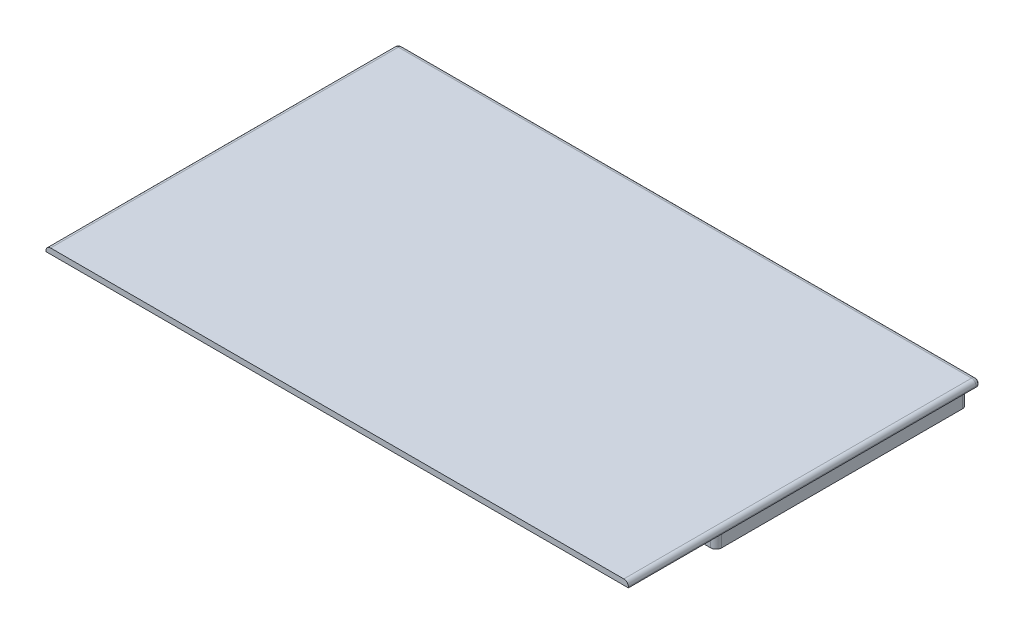
from build123d import *

# Parameters (mm, degrees)
BOSS_EXTRUDE1_DEPTH      = 1.25
SKETCH1_W                = 156
SKETCH1_H                = 69.5
BOSS_EXTRUDE2_DEPTH      = 105
SKETCH4_R                = 2.5000000000000027
BOSS_EXTRUDE3_DEPTH      = 8
FILLET2_R                = 2
SKETCH5_R                = 1.5499999999999998
SKETCH5_R_2              = 1.5500000000000012
CUT_EXTRUDE1_DEPTH       = 8
SKETCH6_R                = 8.25
CUT_EXTRUDE2_DEPTH       = 8
SKETCH8_R                = 3.750000000000007
SKETCH8_R_2              = 3.0000000000000084
SKETCH8_W                = 7.000000000000014
SKETCH8_H                = 14
CUT_EXTRUDE3_DEPTH       = 8
FILLET3_R                = 1.25
FILLET4_R                = 1.25
SKETCH11_R               = 1.5499999999999932
CUT_EXTRUDE4_DEPTH       = 8
BOSS_EXTRUDE5_REACH      = 209.004
FILLET5_R                = 1.25
SKETCH14_R               = 1.5249999999999995
CUT_EXTRUDE5_DEPTH       = 8
BOSS_EXTRUDE6_DEPTH      = 5
CUT_EXTRUDE10_DEPTH      = 176.50000000000017
CUT_EXTRUDE10_DEPTH_BACK = 9
SKETCH19_R               = 1.5249999999999995
BOSS_EXTRUDE7_DEPTH      = 1.5
SKETCH17_W               = 214.39373035957487
SKETCH17_H               = 311.75060194691184
CUT_EXTRUDE6_DEPTH       = 142.50000000000003
SKETCH18_W               = 843.8612520819788
SKETCH18_H               = 210.19069540658822
CUT_EXTRUDE7_DEPTH       = 211.50000000000009
FILLET6_R                = 1.25
SKETCH21_R               = 1.5249999999999995
CUT_EXTRUDE11_DEPTH      = 46.50000000000004
SKETCH22_R               = 1.5249999999999952
SKETCH22_R_2             = 0.49999999999999917
SKETCH22_R_3             = 0.9999999999999983
CUT_EXTRUDE12_DEPTH      = 46.50000000000004
SKETCH23_W               = 224.34927592813784
SKETCH23_H               = 20
CUT_EXTRUDE13_DEPTH      = 108.00000000000004
SKETCH24_W               = 223.8278832276348
SKETCH24_H               = 83.20006380200533
CUT_EXTRUDE14_DEPTH      = 108.00000000000004


with BuildPart() as part:
    # Sketch2 → Boss-Extrude1 (new body)
    with BuildSketch(Plane(origin=(0, 0, 0), x_dir=(1, 0, 0), z_dir=(0, 1, 0))):
        Polygon((-79.25000000000004, 35.99999999999998), (79.24999999999996, 35.99999999999999), (79.24999999999999, -159.00000000000003), (-79.25000000000001, -159.00000000000003), align=None)
    extrude(amount=-BOSS_EXTRUDE1_DEPTH)

    # Sketch1 → Boss-Extrude2 (add)
    with BuildSketch(Plane(origin=(0, 0, 0), x_dir=(1, 0, 0), z_dir=(0, 1, 0))):
        Polygon((79.24999999999999, -159.00000000000003), (-79.25000000000001, -159.00000000000003), (-79.25000000000004, -86.00000000000001), (-79.25000000000004, -36.00000000000002), (-79.25000000000004, 35.99999999999998), (79.24999999999996, 35.99999999999999), (79.24999999999996, -36.00000000000002), (79.24999999999996, -86.00000000000001), align=None)
        Polygon((-78.00000000000001, -157.75000000000006), (77.99999999999999, -157.75000000000006), (77.99999999999996, -86.00000000000001), (77.99999999999996, -36.00000000000002), (-78.00000000000004, -36.00000000000002), (-78.00000000000004, -86.00000000000001), (-78.00000000000004, -100.58859756900745), align=None, mode=Mode.SUBTRACT)
        Rectangle(SKETCH1_W, SKETCH1_H, mode=Mode.SUBTRACT)
    extrude(amount=BOSS_EXTRUDE2_DEPTH)

    # Sketch4 → Boss-Extrude3 (add)
    with BuildSketch(Plane(origin=(0, 0, 0), x_dir=(1, 0, 0), z_dir=(0, 1, 0))):
        with Locations(Location((-37.074999999999996, -117.75000000000004, 0), (0, 0, 90))):
            Circle(SKETCH4_R)
        with Locations(Location((37.074999999999996, -117.75000000000003, 0), (0, 0, 90))):
            Circle(SKETCH4_R)
    extrude(amount=BOSS_EXTRUDE3_DEPTH)

    # Fillet2
    fillet2_edges = [part.edges().sort_by_distance(p)[0] for p in [
        (77.99999999999996, 52.5, -34.749999999999986),
        (77.99999999999996, 52.5, 34.750000000000014),
        (-78.00000000000004, 0, 1.421e-14),
        (-78.00000000000004, 52.5, 34.750000000000014),
        (77.99999999999999, 52.5, 157.75000000000006),
        (-78.00000000000001, 52.5, 157.75000000000006),
        (-4.263e-14, 0, 36.00000000000002),
        (-78.00000000000004, 52.5, 36.00000000000002),
        (77.99999999999997, 0, 96.87500000000003),
        (77.99999999999996, 52.5, 36.00000000000002),
        (-4.263e-14, 0, -34.749999999999986),
        (-78.00000000000004, 52.5, -34.749999999999986),
        (-1.421e-14, 0, 157.75000000000006),
        (-78.00000000000003, 0, 96.87500000000004),
        (77.99999999999996, 0, 1.421e-14),
        (-4.263e-14, 0, 34.750000000000014),
        (-37.074999999999996, 0, 120.25000000000004),
        (37.074999999999996, 0, 120.25000000000003),
    ]]
    fillet(fillet2_edges, radius=FILLET2_R)

    # Sketch5 → Cut-Extrude1 (cut)
    with BuildSketch(Plane.XY.offset(36.00000000000002)):
        with BuildLine():
            ThreePointArc((-53.750000000000085, 99.54999999999998), (-54.84601551083924, 99.09601551083914), (-55.30000000000008, 97.99999999999999))
            Line((-55.30000000000008, 97.99999999999999), (-53.750000000000085, 97.99999999999999))
            Line((-53.750000000000085, 97.99999999999999), (-53.750000000000085, 99.54999999999998))
        make_face()
        with BuildLine():
            Line((-53.750000000000085, 97.99999999999999), (-55.30000000000008, 97.99999999999999))
            ThreePointArc((-55.30000000000008, 97.99999999999999), (-53.750000000000085, 96.44999999999999), (-52.20000000000009, 97.99999999999999))
            ThreePointArc((-52.20000000000009, 97.99999999999999), (-52.65398448916093, 99.09601551083914), (-53.750000000000085, 99.54999999999998))
            Line((-53.750000000000085, 99.54999999999998), (-53.750000000000085, 97.99999999999999))
        make_face()
        with Locations((53.750000000000206, 97.99999999999967)):
            Circle(SKETCH5_R)
        with Locations((-53.750000000000085, 7.999999999999743)):
            Circle(SKETCH5_R_2)
        with Locations((53.749999999999666, 7.9999999999994245)):
            Circle(SKETCH5_R_2)
    extrude(amount=-CUT_EXTRUDE1_DEPTH, mode=Mode.SUBTRACT)

    # Sketch6 → Cut-Extrude2 (cut)
    with BuildSketch(Plane(origin=(0, 0, 157.75000000000006), x_dir=(-1, 0, 0), z_dir=(0, 0, -1))):
        with Locations((0, 22)):
            Circle(SKETCH6_R)
    extrude(amount=-CUT_EXTRUDE2_DEPTH, mode=Mode.SUBTRACT)

    # Sketch8 → Cut-Extrude3 (cut)
    with BuildSketch(Plane.ZY.offset(79.25000000000004)):
        with Locations((131.5, 54.99999999999998)):
            Circle(SKETCH8_R)
        with Locations((101.50000000000001, 54.99999999999998)):
            Circle(SKETCH8_R_2)
        with Locations((116.50000000000003, 64.99999999999999)):
            Rectangle(SKETCH8_W, SKETCH8_H)
        with Locations((101.50000000000001, 64.99999999999997)):
            Circle(SKETCH8_R_2)
        with Locations((101.50000000000001, 74.99999999999997)):
            Circle(SKETCH8_R_2)
        with Locations((101.50000000000001, 84.99999999999997)):
            Circle(SKETCH8_R_2)
        with Locations((131.5, 74.99999999999999)):
            Circle(SKETCH8_R)
    extrude(amount=-CUT_EXTRUDE3_DEPTH, mode=Mode.SUBTRACT)

    # Fillet3
    fillet3_edges = [part.edges().sort_by_distance(p)[0] for p in [
        (79.24999999999997, -1.25, 61.50000000000002),
        (-4.263e-14, -1.25, -35.999999999999986),
        (-79.25000000000003, -1.25, 61.50000000000003),
        (-1.421e-14, -1.25, 159.00000000000003),
    ]]
    fillet(fillet3_edges, radius=FILLET3_R)

    # Fillet4
    # the kernel refuses this fillet: 1.25 mm, written as the material it takes off along each edge
    with BuildSketch(Plane(origin=(-78.00000000000004, 0, -34.74999999999997), x_dir=(-9e-17, 0, -1), z_dir=(-1, 0, 1.5e-16))) as fillet4_piece_1_section:
        Polygon((0, 0), (FILLET4_R, 0), (FILLET4_R, FILLET4_R), (0, FILLET4_R), align=None)
    fillet4_piece_1 = extrude(amount=FILLET4_R, mode=Mode.PRIVATE)
    fillet4_piece_1 = fillet4_piece_1 - Plane(origin=(-78.00000000000004, 0, -34.74999999999997), x_dir=(0, 0.7071067811865475, 0.7071067811865475), z_dir=(-1, 0, 1.5e-16)) * Sphere(FILLET4_R, mode=Mode.PRIVATE)
    add(fillet4_piece_1, mode=Mode.SUBTRACT)
    with BuildSketch(Plane(origin=(77.99999999999996, 0, -34.74999999999999), x_dir=(-9e-17, 0, -1), z_dir=(1, 0, -1.5e-16))) as fillet4_piece_2_section:
        Polygon((0, 0), (FILLET4_R, 0), (FILLET4_R, -FILLET4_R), (0, -FILLET4_R), align=None)
    fillet4_piece_2 = extrude(amount=FILLET4_R, mode=Mode.PRIVATE)
    fillet4_piece_2 = fillet4_piece_2 - Plane(origin=(77.99999999999996, 0, -34.74999999999999), x_dir=(0, 0.7071067811865475, 0.7071067811865475), z_dir=(1, 0, -1.5e-16)) * Sphere(FILLET4_R, mode=Mode.PRIVATE)
    add(fillet4_piece_2, mode=Mode.SUBTRACT)
    with BuildSketch(Plane(origin=(-78.00000000000001, 0, 157.75000000000003), x_dir=(-1, 0, 1.5e-16), z_dir=(0, 0, 1))) as fillet4_piece_3_section:
        Polygon((0, 0), (FILLET4_R, 0), (FILLET4_R, FILLET4_R), (0, FILLET4_R), align=None)
    fillet4_piece_3 = extrude(amount=FILLET4_R, mode=Mode.PRIVATE)
    fillet4_piece_3 = fillet4_piece_3 - Plane(origin=(-78.00000000000001, 0, 157.75000000000003), x_dir=(0.7071067811865475, 0.7071067811865475, 0), z_dir=(0, 0, 1)) * Sphere(FILLET4_R, mode=Mode.PRIVATE)
    add(fillet4_piece_3, mode=Mode.SUBTRACT)
    with BuildSketch(Plane(origin=(77.99999999999999, 0, 157.75000000000003), x_dir=(1, 0, -1.5e-16), z_dir=(0, 0, 1))) as fillet4_piece_4_section:
        Polygon((0, 0), (FILLET4_R, 0), (FILLET4_R, -FILLET4_R), (0, -FILLET4_R), align=None)
    fillet4_piece_4 = extrude(amount=FILLET4_R, mode=Mode.PRIVATE)
    fillet4_piece_4 = fillet4_piece_4 - Plane(origin=(77.99999999999999, 0, 157.75000000000003), x_dir=(-0.7071067811865475, 0.7071067811865475, 0), z_dir=(0, 0, 1)) * Sphere(FILLET4_R, mode=Mode.PRIVATE)
    add(fillet4_piece_4, mode=Mode.SUBTRACT)
    with BuildSketch(Plane(origin=(79.24999999999999, 108.12500000000007, 159.00000000000003), x_dir=(-1, 0, 0), z_dir=(0, -1, 0))) as fillet4_piece_5:
        with BuildLine():
            CenterArc((FILLET4_R, FILLET4_R), FILLET4_R, 179.9999999999987, 90.00000000000131)
            Line((0, FILLET4_R), (0, 0))
            Line((0, 0), (FILLET4_R, 0))
        make_face()
    extrude(amount=108.12500000000007, mode=Mode.SUBTRACT)
    with BuildSketch(Plane(origin=(-79.25000000000001, -2.2e-16, 159.00000000000003), x_dir=(1, 0, 0), z_dir=(0, 1, 0))) as fillet4_piece_6:
        with BuildLine():
            CenterArc((FILLET4_R, FILLET4_R), FILLET4_R, 180, 90)
            Line((0, FILLET4_R), (0, 0))
            Line((0, 0), (FILLET4_R, 0))
        make_face()
    extrude(amount=108.12499999999999, mode=Mode.SUBTRACT)
    with BuildSketch(Plane(origin=(79.24999999999996, 108.125, -35.99999999999999), x_dir=(0, 0, 1), z_dir=(0, -1, 0))) as fillet4_piece_7:
        with BuildLine():
            CenterArc((FILLET4_R, FILLET4_R), FILLET4_R, 180, 90)
            Line((0, FILLET4_R), (0, 0))
            Line((0, 0), (FILLET4_R, 0))
        make_face()
    extrude(amount=108.125, mode=Mode.SUBTRACT)
    with BuildSketch(Plane(origin=(-79.25000000000004, -2.2e-16, -35.99999999999998), x_dir=(0, 0, 1), z_dir=(0, 1, 0))) as fillet4_piece_8:
        with BuildLine():
            CenterArc((FILLET4_R, FILLET4_R), FILLET4_R, 180, 90)
            Line((-2.132e-14, FILLET4_R), (0, 0))
            Line((0, 0), (FILLET4_R, 0))
        make_face()
    extrude(amount=108.12499999999999, mode=Mode.SUBTRACT)

    # Sketch11 → Cut-Extrude4 (cut)
    with BuildSketch(Plane(origin=(79.24999999999996, 0, -1.128e-14), x_dir=(-1.4e-16, 0, -1), z_dir=(1, 0, -1.4e-16))):
        with BuildLine():
            ThreePointArc((-13.05000000000001, 102.49999999999999), (-12.596015510839159, 101.40398448916083), (-11.50000000000001, 100.94999999999999))
            Line((-11.50000000000001, 100.94999999999999), (-11.50000000000001, 102.49999999999999))
            Line((-11.500000000000014, 102.49999999999999), (-13.050000000000011, 102.49999999999999))
        make_face()
        with BuildLine():
            Line((-11.50000000000001, 102.49999999999999), (-11.50000000000001, 100.94999999999999))
            ThreePointArc((-11.50000000000001, 100.94999999999999), (-10.403984489160864, 101.40398448916083), (-9.950000000000012, 102.49999999999999))
            ThreePointArc((-9.950000000000012, 102.49999999999999), (-11.50000000000001, 104.04999999999998), (-13.05000000000001, 102.49999999999999))
            Line((-13.050000000000011, 102.49999999999999), (-11.500000000000014, 102.49999999999999))
        make_face()
        with BuildLine():
            ThreePointArc((-25.550000000000008, 90), (-25.096015510839155, 88.90398448916085), (-24.000000000000007, 88.45))
            Line((-24.000000000000007, 88.45000000000002), (-24.000000000000007, 90))
            Line((-24, 90), (-25.55000000000001, 90))
        make_face()
        with BuildLine():
            Line((-24.000000000000007, 90), (-24.000000000000007, 88.45000000000002))
            ThreePointArc((-24.000000000000007, 88.45), (-22.90398448916086, 88.90398448916085), (-22.450000000000006, 90))
            ThreePointArc((-22.450000000000006, 90), (-24.000000000000007, 91.55), (-25.550000000000008, 90))
            Line((-25.55000000000001, 90), (-24, 90))
        make_face()
        with BuildLine():
            ThreePointArc((-9.949999999999998, 2.4999999999999742), (-10.403984489160848, 3.5960155108391216), (-11.499999999999995, 4.049999999999974))
            Line((-11.499999999999996, 4.049999999999969), (-11.499999999999996, 2.4999999999999716))
            Line((-11.5, 2.4999999999999742), (-13.049999999999997, 2.4999999999999742))
            ThreePointArc((-13.049999999999995, 2.4999999999999742), (-11.499999999999996, 0.9499999999999749), (-9.949999999999998, 2.499999999999974))
        make_face()
        with BuildLine():
            Line((-11.499999999999996, 2.4999999999999716), (-11.499999999999996, 4.049999999999969))
            ThreePointArc((-11.499999999999995, 4.049999999999974), (-12.596015510839145, 3.596015510839123), (-13.049999999999995, 2.4999999999999742))
            Line((-13.049999999999997, 2.4999999999999742), (-11.5, 2.4999999999999742))
        make_face()
        with BuildLine():
            ThreePointArc((-111.5, 4.049999999999969), (-112.59601551083915, 1.40398448916083), (-109.95, 2.499999999999974))
            Line((-109.95, 2.4999999999999742), (-111.5, 2.4999999999999742))
            Line((-111.5, 2.4999999999999716), (-111.5, 4.049999999999969))
        make_face()
        with BuildLine():
            Line((-111.5, 2.4999999999999742), (-109.95, 2.4999999999999742))
            ThreePointArc((-109.95, 2.4999999999999742), (-110.40398448916086, 3.5960155108391185), (-111.5, 4.049999999999969))
            Line((-111.5, 4.049999999999969), (-111.5, 2.4999999999999716))
        make_face()
        with BuildLine():
            ThreePointArc((-97.45, 14.999999999999993), (-97.90398448916086, 16.096015510839138), (-99, 16.549999999999986))
            Line((-99, 16.549999999999986), (-99, 14.999999999999993))
            Line((-99, 14.999999999999993), (-97.45, 14.999999999999993))
        make_face()
        with BuildLine():
            Line((-99, 14.999999999999993), (-99, 16.549999999999986))
            ThreePointArc((-99, 16.549999999999986), (-100.09601551083915, 13.903984489160848), (-97.45, 14.999999999999993))
            Line((-97.45, 14.999999999999993), (-99, 14.999999999999993))
        make_face()
        with BuildLine():
            ThreePointArc((-22.450000000000006, 14.999999999999993), (-22.90398448916086, 16.09601551083914), (-24.000000000000007, 16.549999999999994))
            Line((-24.000000000000007, 16.549999999999994), (-24.000000000000007, 14.999999999999993))
            Line((-24, 14.999999999999993), (-25.55000000000001, 14.999999999999993))
            ThreePointArc((-25.550000000000008, 14.999999999999993), (-24.000000000000007, 13.449999999999992), (-22.450000000000006, 14.999999999999993))
        make_face()
        with BuildLine():
            Line((-24.000000000000007, 14.999999999999993), (-24.000000000000007, 16.549999999999994))
            ThreePointArc((-24.000000000000007, 16.549999999999994), (-25.096015510839155, 16.09601551083914), (-25.550000000000008, 14.999999999999993))
            Line((-25.55000000000001, 14.999999999999993), (-24, 14.999999999999993))
        make_face()
        with Locations((-111.50000000000001, 102.49999999999999)):
            Circle(SKETCH11_R)
        with Locations((-99, 90)):
            Circle(SKETCH11_R)
    extrude(amount=-CUT_EXTRUDE4_DEPTH, mode=Mode.SUBTRACT)

    # Boss-Extrude5: up to this face of the body (flat: up to its plane)
    boss_extrude5_end = Plane(part.part.faces().sort_by_distance((0, 0, 96.725539908))[0])
    # Sketch12 → Boss-Extrude5 (add, up to the picked face)
    with BuildSketch(Plane(origin=(0, 105, 0), x_dir=(1, 0, 0), z_dir=(0, 1, 0)), mode=Mode.PRIVATE) as boss_extrude5_sk1:
        with BuildLine():
            Line((73, -152.75000000000043), (72.99999999999997, -157.75000000000043))
            Line((72.99999999999997, -157.75000000000043), (75.99999999999996, -157.75000000000045))
            ThreePointArc((75.99999999999996, -157.75000000000006), (77.41421356237305, -157.16421356237316), (77.99999999999994, -155.75000000000006))
            Line((77.99999999999999, -155.75000000000006), (78, -152.75000000000045))
            Line((78, -152.75000000000045), (73, -152.75000000000043))
        make_face()
    boss_extrude5_tool1 = split(extrude(boss_extrude5_sk1.sketch, amount=-BOSS_EXTRUDE5_REACH, mode=Mode.PRIVATE), bisect_by=boss_extrude5_end, keep=Keep.BOTH, mode=Mode.PRIVATE)
    # Sketch12 → Boss-Extrude5 (add, up to the picked face)
    with BuildSketch(Plane(origin=(0, 105, 0), x_dir=(1, 0, 0), z_dir=(0, 1, 0)), mode=Mode.PRIVATE) as boss_extrude5_sk2:
        with BuildLine():
            ThreePointArc((-78.00000000000003, -155.75000000000006), (-77.41421356237313, -157.16421356237316), (-76.00000000000003, -157.75000000000006))
            Line((-76.00000000000003, -157.75000000000006), (-73.00000000000003, -157.75000000000006))
            Line((-73.00000000000003, -157.75000000000006), (-73.00000000000003, -152.75000000000006))
            Line((-73.00000000000003, -152.75000000000006), (-78.00000000000003, -152.75000000000006))
            Line((-78.00000000000003, -152.75000000000006), (-78.00000000000003, -155.75000000000006))
        make_face()
    boss_extrude5_tool2 = split(extrude(boss_extrude5_sk2.sketch, amount=-BOSS_EXTRUDE5_REACH, mode=Mode.PRIVATE), bisect_by=boss_extrude5_end, keep=Keep.BOTH, mode=Mode.PRIVATE)
    add(boss_extrude5_tool1.solids().sort_by(Axis((75.426992, 105, 155.176992), (0, -1, 0)))[0])
    add(boss_extrude5_tool2.solids().sort_by(Axis((-75.426992, 105, 155.176992), (0, -1, 0)))[0])

    # Fillet5
    fillet5_edges = [part.edges().sort_by_distance(p)[0] for p in [
        (77.41421356237306, 0.5857864376269042, 152.75000000000043),
        (72.99999999999999, 0.5857864376269046, 157.16421356237316),
        (72.99999999999997, 53.5, 157.75000000000043),
        (74.49999999999999, 0, 152.75000000000043),
        (73, 52.5, 152.75000000000043),
        (78, 53.5, 152.75000000000045),
        (73, 0, 154.25000000000023),
        (-77.41421356237313, 0.5857864376269042, 152.75000000000006),
        (-73.00000000000003, 0, 154.25000000000006),
        (-73.00000000000003, 52.5, 152.75000000000006),
        (-78.00000000000003, 53.5, 152.75000000000006),
        (-74.50000000000003, 0, 152.75000000000006),
        (-73.00000000000003, 0.5857864376269046, 157.16421356237316),
        (-73.00000000000003, 53.5, 157.75000000000006),
    ]]
    fillet(fillet5_edges, radius=FILLET5_R)

    # Sketch14 → Cut-Extrude5 (cut)
    with BuildSketch(Plane(origin=(0, 105, 0), x_dir=(1, 0, 0), z_dir=(0, 1, 0))):
        with Locations(Location((75.68305826175839, -155.43305826175865, 0), (0, 0, 270))):
            Circle(SKETCH14_R)
        with Locations(Location((-75.68305826175845, -155.43305826175828, 0), (0, 0, 270))):
            Circle(SKETCH14_R)
    extrude(amount=-CUT_EXTRUDE5_DEPTH, mode=Mode.SUBTRACT)

    # Sketch19 → Cut-Extrude10 (cut, two sides: drawn at the far end of the back side and taken through both)
    with BuildSketch(Plane(origin=(0, 105, 0), x_dir=(1, 0, 0), z_dir=(0, 1, 0)).offset(-CUT_EXTRUDE10_DEPTH_BACK)):
        with Locations(Location((75.68305826175839, -155.43305826175865, 0), (0, 0, 270))):
            Circle(SKETCH19_R)
        with Locations(Location((-75.68305826175845, -155.43305826175828, 0), (0, 0, 270))):
            Circle(SKETCH19_R)
    extrude(amount=CUT_EXTRUDE10_DEPTH + CUT_EXTRUDE10_DEPTH_BACK, mode=Mode.SUBTRACT)



with BuildPart() as body_2:
    # Sketch15 → Boss-Extrude6 (new body)
    with BuildSketch(Plane(origin=(0, 105, 0), x_dir=(1, 0, 0), z_dir=(0, 1, 0))):
        with BuildLine():
            Line((-77.50000000000004, 32.749999999999986), (-77.50000000000004, -32.750000000000014))
            ThreePointArc((-77.50000000000004, -32.750000000000014), (-77.06066017177986, -33.81066017177984), (-76.00000000000004, -34.250000000000014))
            Line((-76.00000000000004, -34.250000000000014), (75.99999999999996, -34.250000000000014))
            ThreePointArc((75.99999999999996, -34.250000000000014), (77.06066017177977, -33.81066017177984), (77.49999999999996, -32.750000000000014))
            Line((77.49999999999996, -32.750000000000014), (77.49999999999996, 32.749999999999986))
            ThreePointArc((77.49999999999996, 32.749999999999986), (77.06066017177977, 33.81066017177981), (75.99999999999996, 34.249999999999986))
            Line((75.99999999999996, 34.249999999999986), (-76.00000000000004, 34.249999999999986))
            ThreePointArc((-76.00000000000004, 34.249999999999986), (-77.06066017177986, 33.81066017177981), (-77.50000000000004, 32.749999999999986))
        make_face()
        with BuildLine():
            Line((75.99999999999996, 32.999999999999986), (-76.00000000000004, 32.999999999999986))
            ThreePointArc((-76.00000000000004, 32.999999999999986), (-76.17677669529668, 32.926776695296624), (-76.25000000000004, 32.749999999999986))
            Line((-76.25000000000004, 32.749999999999986), (-76.25000000000004, -32.750000000000014))
            ThreePointArc((-76.25000000000004, -32.750000000000014), (-76.17677669529668, -32.92677669529665), (-76.00000000000004, -33.000000000000014))
            Line((-76.00000000000004, -33.000000000000014), (75.99999999999996, -33.000000000000014))
            ThreePointArc((75.99999999999996, -33.000000000000014), (76.1767766952966, -32.92677669529665), (76.24999999999996, -32.750000000000014))
            Line((76.24999999999996, -32.750000000000014), (76.24999999999996, 32.749999999999986))
            ThreePointArc((76.24999999999996, 32.749999999999986), (76.1767766952966, 32.926776695296624), (75.99999999999996, 32.999999999999986))
        make_face(mode=Mode.SUBTRACT)
    extrude(amount=-BOSS_EXTRUDE6_DEPTH)


with BuildPart() as part_1:
    add(part.part)

    add(body_2.part)  # Boss-Extrude7 merges body 2
    # Sketch16 → Boss-Extrude7 (add)
    with BuildSketch(Plane(origin=(0, 105, 0), x_dir=(1, 0, 0), z_dir=(0, 1, 0))):
        with BuildLine():
            Line((-79.25000000000004, 34.74999999999998), (-79.25000000000004, -157.75000000000003))
            ThreePointArc((-79.25000000000004, -157.75000000000003), (-78.88388347648322, -158.63388347648322), (-78.00000000000001, -159.00000000000003))
            Line((-78.00000000000001, -159.00000000000003), (77.99999999999999, -159.00000000000003))
            ThreePointArc((77.99999999999999, -159.00000000000003), (78.88388347648316, -158.63388347648322), (79.24999999999999, -157.75000000000003))
            Line((79.24999999999999, -157.75000000000003), (79.24999999999991, 34.749999999999986))
            ThreePointArc((79.24999999999991, 34.749999999999986), (78.8838834764831, 35.63388347648314), (77.99999999999996, 35.99999999999997))
            Line((77.99999999999996, 35.99999999999997), (-78.00000000000004, 35.99999999999998))
            ThreePointArc((-78.00000000000004, 35.99999999999998), (-78.88388347648322, 35.63388347648316), (-79.25000000000004, 34.74999999999998))
        make_face()
    extrude(amount=BOSS_EXTRUDE7_DEPTH)

    # Sketch17 → Cut-Extrude6 (cut)
    with BuildSketch(Plane.XZ.offset(-105)):
        with Locations((-9.695908791144348, 54.3605461890202)):
            Rectangle(SKETCH17_W, SKETCH17_H)
        with BuildLine():
            Line((77.99999999999996, -32.749999999999986), (77.99999999999996, 32.750000000000014))
            ThreePointArc((77.99999999999996, 32.750000000000014), (77.41421356237305, 34.16421356237311), (75.99999999999996, 34.750000000000014))
            Line((75.99999999999996, 34.750000000000014), (-76.00000000000004, 34.750000000000014))
            ThreePointArc((-76.00000000000004, 34.750000000000014), (-77.41421356237313, 34.16421356237311), (-78.00000000000004, 32.750000000000014))
            Line((-78.00000000000004, 32.750000000000014), (-78.00000000000004, -32.749999999999986))
            ThreePointArc((-78.00000000000004, -32.749999999999986), (-77.41421356237313, -34.16421356237308), (-76.00000000000004, -34.749999999999986))
            Line((-76.00000000000004, -34.749999999999986), (75.99999999999996, -34.749999999999986))
            ThreePointArc((75.99999999999996, -34.749999999999986), (77.41421356237305, -34.16421356237308), (77.99999999999996, -32.749999999999986))
        make_face(mode=Mode.SUBTRACT)
    extrude(amount=CUT_EXTRUDE6_DEPTH, mode=Mode.SUBTRACT)


with BuildPart() as cut_extrude6_piece_1:
    # of the separate pieces the step leaves, piece 1, a body of its own (cut_extrude6_pieces)
    add(part_1.part.solids().sort_by_distance((-76, 105, -34.25))[0])

    # Fillet6
    fillet6_edges = [cut_extrude6_piece_1.edges().sort_by_distance(p)[0] for p in [
        (-78.88388347648322, 106.5, -35.633883476483156),
        (-79.25000000000004, 106.5, 61.50000000000002),
        (-78.88388347648322, 106.5, 158.63388347648322),
        (-1.421e-14, 106.5, 159.00000000000003),
        (78.88388347648318, 106.5, 158.63388347648322),
        (79.24999999999994, 106.5, 61.50000000000003),
        (78.8838834764831, 106.5, -35.63388347648314),
        (-4.263e-14, 106.5, -35.99999999999997),
    ]]
    fillet(fillet6_edges, radius=FILLET6_R)

    # Sketch21 → Cut-Extrude11 (cut)
    with BuildSketch(Plane(origin=(0, 106.5, 0), x_dir=(1, 0, 0), z_dir=(0, 1, 0))):
        with Locations(Location((-75.68068975770814, -155.43068975770817, 0), (0, 0, 270))):
            Circle(SKETCH21_R)
        with Locations(Location((75.68068975770811, -155.43068975770834, 0), (0, 0, 270))):
            Circle(SKETCH21_R)
    extrude(amount=-CUT_EXTRUDE11_DEPTH, mode=Mode.SUBTRACT)

    # Sketch22 → Cut-Extrude12 (cut)
    with BuildSketch(Plane(origin=(0, 106.5, 0), x_dir=(1, 0, 0), z_dir=(0, 1, 0))):
        with Locations(Location((-53.000000000000014, -122.75000000000003, 0), (0, 0, 270))):
            Circle(SKETCH22_R)
        with Locations(Location((53.000000000000014, -121.25000000000003, 0), (0, 0, 270))):
            Circle(SKETCH22_R_2)
        with Locations(Location((53.000000000000014, -124.25000000000003, 0), (0, 0, 270))):
            Circle(SKETCH22_R_2)
        with Locations(Location((48.000000000000014, -122.75000000000003, 0), (0, 0, 270))):
            Circle(SKETCH22_R_3)
    extrude(amount=-CUT_EXTRUDE12_DEPTH, mode=Mode.SUBTRACT)

    # Sketch23 → Cut-Extrude13 (cut)
    with BuildSketch(Plane.XZ.offset(-105)):
        with Locations((5.748765940339929, 69.87855319631414)):
            Rectangle(SKETCH23_W, SKETCH23_H)
    extrude(amount=-CUT_EXTRUDE13_DEPTH, mode=Mode.SUBTRACT)


with BuildPart() as cut_extrude6_piece_2:
    # of the separate pieces the step leaves, piece 2, a body of its own (cut_extrude6_pieces)
    add(part_1.part.solids().sort_by_distance((-78, 2, -32.75))[0])

    # Sketch18 → Cut-Extrude7 (cut)
    with BuildSketch(Plane.XZ.offset(-99.99999999999999)):
        Rectangle(SKETCH18_W, SKETCH18_H)
    extrude(amount=CUT_EXTRUDE7_DEPTH, mode=Mode.SUBTRACT)


with BuildPart() as cut_extrude13_piece_1:
    # of the separate pieces the step leaves, piece 1, a body of its own (cut_extrude13_pieces)
    add(cut_extrude6_piece_1.part.solids().sort_by_distance((-79.25, 105, 59.878553196))[0])


with BuildPart() as cut_extrude13_piece_2:
    # of the separate pieces the step leaves, piece 2, a body of its own (cut_extrude13_pieces)
    add(cut_extrude6_piece_1.part.solids().sort_by_distance((-78, 105.25, 159))[0])

    # Sketch24 → Cut-Extrude14 (cut)
    with BuildSketch(Plane(origin=(0, 0, 79.87855319631414), x_dir=(-1, 0, 0), z_dir=(0, 0, -1))):
        with Locations((-6.53504656057757, 105)):
            Rectangle(SKETCH24_W, SKETCH24_H)
    extrude(amount=-CUT_EXTRUDE14_DEPTH, mode=Mode.SUBTRACT)


solid = cut_extrude13_piece_1.part
